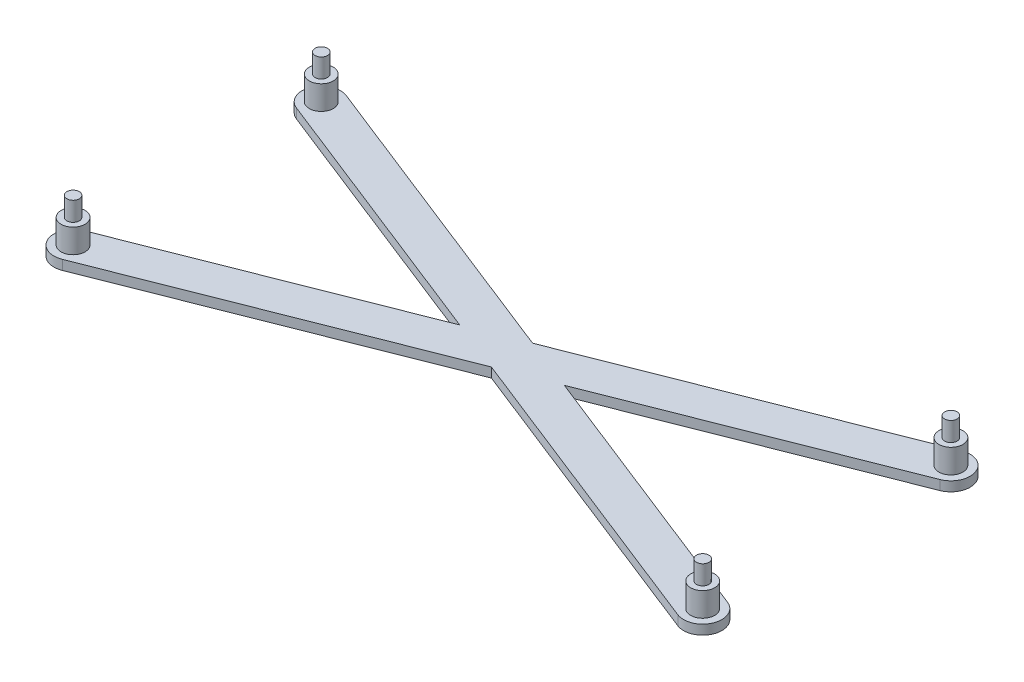
from build123d import *

# Parameters (mm, degrees)
SKETCH1_W               = 70
SKETCH1_H               = 30
SKETCH1_R               = 0.65
BOSS_EXTRUDE2_DEPTH     = 1
SKETCH2_R               = 0.65
BOSS_EXTRUDE3_DEPTH     = 1
BOSS_EXTRUDE4_START     = 3.5
SKETCH4_R               = 0.65
BOSS_EXTRUDE4_DEPTH     = 3.5
SKETCH5_R               = 1.25
BOSS_EXTRUDE7_DEPTH     = 2.5
CUT_EXTRUDE3_DEPTH      = 77.290562981
CUT_EXTRUDE3_DEPTH_BACK = 77.290562981
SKETCH6_R               = 70.156119208


with BuildPart() as part:
    # Sketch1 → Boss-Extrude2 (new body)
    with BuildSketch(Plane(origin=(0, 0, 0), x_dir=(1, 0, 0), z_dir=(0, 1, 0))):
        with Locations((35, 15)):
            Rectangle(SKETCH1_W, SKETCH1_H)
        with Locations((2.15, 27.95)):
            Circle(SKETCH1_R, mode=Mode.SUBTRACT)
        with Locations((2.15, 2.05)):
            Circle(SKETCH1_R, mode=Mode.SUBTRACT)
        with Locations((67.85, 27.95)):
            Circle(SKETCH1_R, mode=Mode.SUBTRACT)
        with Locations((67.85, 2.05)):
            Circle(SKETCH1_R, mode=Mode.SUBTRACT)
    extrude(amount=BOSS_EXTRUDE2_DEPTH)

    # Sketch2 → Boss-Extrude3 (add, symmetric)
    with BuildSketch(Plane(origin=(0, 1, 0), x_dir=(1, 0, 0), z_dir=(0, 1, 0))):
        with Locations((2.15, 27.95)):
            Circle(SKETCH2_R)
        with Locations((2.15, 2.05)):
            Circle(SKETCH2_R)
        with Locations((67.85, 2.05)):
            Circle(SKETCH2_R)
        with Locations((67.85, 27.95)):
            Circle(SKETCH2_R)
    extrude(amount=BOSS_EXTRUDE3_DEPTH, both=True)

    # Sketch4 → Boss-Extrude4 (add)
    with BuildSketch(Plane(origin=(0, 2, 0), x_dir=(1, 0, 0), z_dir=(0, 1, 0)).offset(BOSS_EXTRUDE4_START)):
        with Locations((2.15, 27.95)):
            Circle(SKETCH4_R)
        with Locations((2.15, 2.05)):
            Circle(SKETCH4_R)
        with Locations((67.85, 2.05)):
            Circle(SKETCH4_R)
        with Locations((67.85, 27.95)):
            Circle(SKETCH4_R)
    extrude(amount=-BOSS_EXTRUDE4_DEPTH)

    # Sketch5 → Boss-Extrude7 (add)
    with BuildSketch(Plane(origin=(0, 1, 0), x_dir=(1, 0, 0), z_dir=(0, 1, 0))):
        with Locations((2.15, 27.95)):
            Circle(SKETCH5_R)
        with Locations((2.15, 2.05)):
            Circle(SKETCH5_R)
        with Locations((67.85, 2.05)):
            Circle(SKETCH5_R)
        with Locations((67.85, 27.95)):
            Circle(SKETCH5_R)
    extrude(amount=BOSS_EXTRUDE7_DEPTH)

    # Sketch6 → Cut-Extrude3 (cut, two sides: drawn at the far end of the back side and taken through both)
    with BuildSketch(Plane(origin=(0, 1, 0), x_dir=(1, 0, 0), z_dir=(0, 1, 0)).offset(-CUT_EXTRUDE3_DEPTH_BACK)):
        with Locations((35.830272912, 15)):
            Circle(SKETCH6_R)
        with BuildLine():
            Line((1.416505244, 26.089358862), (29.546654945, 15))
            Line((29.546654945, 15), (1.416505244, 3.910641138))
            ThreePointArc((1.416505244, 3.910641138), (0.289358862, 1.316505244), (2.883494756, 0.189358862))
            Line((2.883494756, 0.189358862), (35, 12.850203395))
            Line((35, 12.850203395), (67.116505244, 0.189358862))
            ThreePointArc((67.116505244, 0.189358862), (69.710641138, 1.316505244), (68.583494756, 3.910641138))
            Line((68.583494756, 3.910641138), (40.453345055, 15))
            Line((40.453345055, 15), (68.583494756, 26.089358862))
            ThreePointArc((68.583494756, 26.089358862), (69.710641138, 28.683494756), (67.116505244, 29.810641138))
            Line((67.116505244, 29.810641138), (35, 17.149796605))
            Line((35, 17.149796605), (2.883494756, 29.810641138))
            ThreePointArc((2.883494756, 29.810641138), (0.289358862, 28.683494756), (1.416505244, 26.089358862))
        make_face(mode=Mode.SUBTRACT)
    extrude(amount=CUT_EXTRUDE3_DEPTH + CUT_EXTRUDE3_DEPTH_BACK, mode=Mode.SUBTRACT)


solid = part.part
